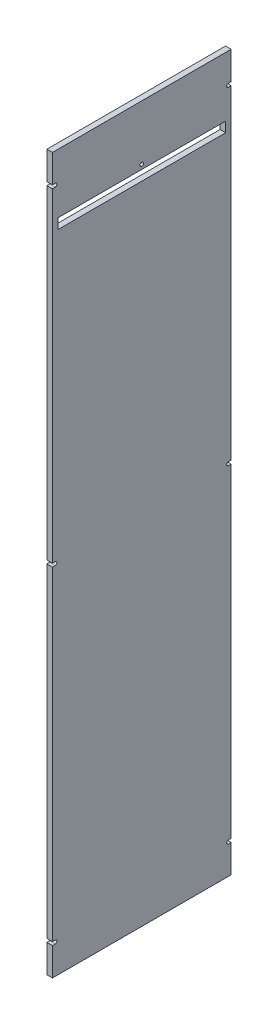
from build123d import *

# Parameters (mm, degrees)
SKETCH1_W             = 4.7625
SKETCH1_H             = 152.4
BOSS_EXTRUDE1_DEPTH   = 609.6
SKETCH2_W             = 142.875
SKETCH2_H             = 8.382
CUT_EXTRUDE1_DEPTH    = 629.379345146
CUT_EXTRUDE2_DEPTH    = 629.379345146
F_4_CLEARANCE_HOLE1_D = 2.9464
SKETCH6_W             = 143.129
SKETCH6_H             = 8.636
SKETCH6_W_2           = 142.875
SKETCH6_H_2           = 8.382
CUT_EXTRUDE3_DEPTH    = 629.379345146


with BuildPart() as part:
    # Sketch1 → Boss-Extrude1 (new body)
    with BuildSketch(Plane(origin=(0, 0, 0), x_dir=(1, 0, 0), z_dir=(0, 1, 0))):
        with Locations((2.38125, 76.2)):
            Rectangle(SKETCH1_W, SKETCH1_H)
    extrude(amount=BOSS_EXTRUDE1_DEPTH)

    # Sketch2 → Cut-Extrude1 (cut, through all)
    with BuildSketch(Plane(origin=(4.7625, 0, 0), x_dir=(0, 0, -1), z_dir=(1, 0, 0))):
        with Locations((76.2, 554.609)):
            Rectangle(SKETCH2_W, SKETCH2_H)
    extrude(amount=-CUT_EXTRUDE1_DEPTH, mode=Mode.SUBTRACT)

    # Sketch3 → Cut-Extrude2 (cut, through all)
    with BuildSketch(Plane.ZY):
        with BuildLine():
            Line((-2.38125, 582.7395), (0, 582.7395))
            Line((0, 582.7395), (0, 585.6605))
            Line((0, 585.6605), (-2.38125, 585.6605))
            ThreePointArc((-2.38125, 585.6605), (-3.84175, 584.2), (-2.38125, 582.7395))
        make_face()
        with BuildLine():
            Line((-150.01875, 585.6605), (-152.4, 585.6605))
            Line((-152.4, 585.6605), (-152.4, 582.7395))
            Line((-152.4, 582.7395), (-150.01875, 582.7395))
            ThreePointArc((-150.01875, 582.7395), (-148.55825, 584.2), (-150.01875, 585.6605))
        make_face()
        with BuildLine():
            Line((-150.01875, 303.3395), (-152.4, 303.3395))
            Line((-152.4, 303.3395), (-152.4, 306.2605))
            Line((-152.4, 306.2605), (-150.01875, 306.2605))
            ThreePointArc((-150.01875, 306.2605), (-148.55825, 304.8), (-150.01875, 303.3395))
        make_face()
        with BuildLine():
            Line((-2.38125, 303.3395), (0, 303.3395))
            Line((0, 303.3395), (0, 306.2605))
            Line((0, 306.2605), (-2.38125, 306.2605))
            ThreePointArc((-2.38125, 306.2605), (-3.84175, 304.8), (-2.38125, 303.3395))
        make_face()
        with BuildLine():
            Line((-2.38125, 23.9395), (0, 23.9395))
            Line((0, 23.9395), (0, 26.8605))
            Line((0, 26.8605), (-2.38125, 26.8605))
            ThreePointArc((-2.38125, 26.8605), (-3.84175, 25.4), (-2.38125, 23.9395))
        make_face()
        with BuildLine():
            Line((-150.01875, 23.9395), (-152.4, 23.9395))
            Line((-152.4, 23.9395), (-152.4, 26.8605))
            Line((-152.4, 26.8605), (-150.01875, 26.8605))
            ThreePointArc((-150.01875, 26.8605), (-148.55825, 25.4), (-150.01875, 23.9395))
        make_face()
    extrude(amount=-CUT_EXTRUDE2_DEPTH, mode=Mode.SUBTRACT)

    # #4 Clearance Hole1 (through all)
    with Locations(Plane.ZY):
        with Locations((-76.2, 562.76875)):
            Hole(F_4_CLEARANCE_HOLE1_D / 2)

    # Sketch6 → Cut-Extrude3 (cut, through all)
    with BuildSketch(Plane.ZY):
        with Locations((-76.2, 554.609)):
            Rectangle(SKETCH6_W, SKETCH6_H)
        with Locations((-76.2, 554.609)):
            Rectangle(SKETCH6_W_2, SKETCH6_H_2, mode=Mode.SUBTRACT)
    extrude(amount=-CUT_EXTRUDE3_DEPTH, mode=Mode.SUBTRACT)


solid = part.part
